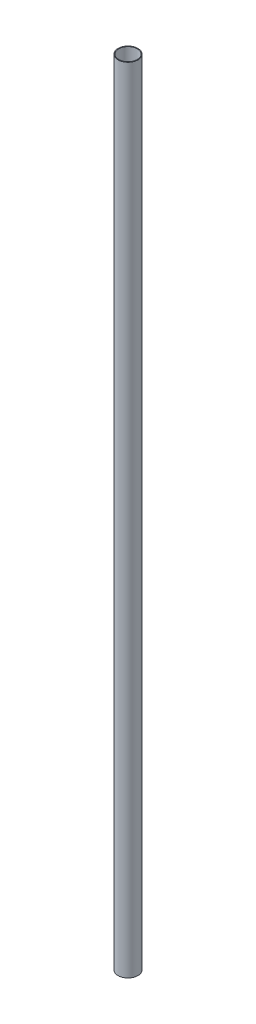
from build123d import *

# Parameters (mm, degrees)
SKETCH1_R           = 3.5
SKETCH1_R_2         = 3.25
BOSS_EXTRUDE1_DEPTH = 278


with BuildPart() as part:
    # Sketch1 → Boss-Extrude1 (new body)
    with BuildSketch(Plane(origin=(0, 0, 0), x_dir=(1, 0, 0), z_dir=(0, 1, 0))):
        Circle(SKETCH1_R)
        Circle(SKETCH1_R_2, mode=Mode.SUBTRACT)
    extrude(amount=BOSS_EXTRUDE1_DEPTH)


solid = part.part
